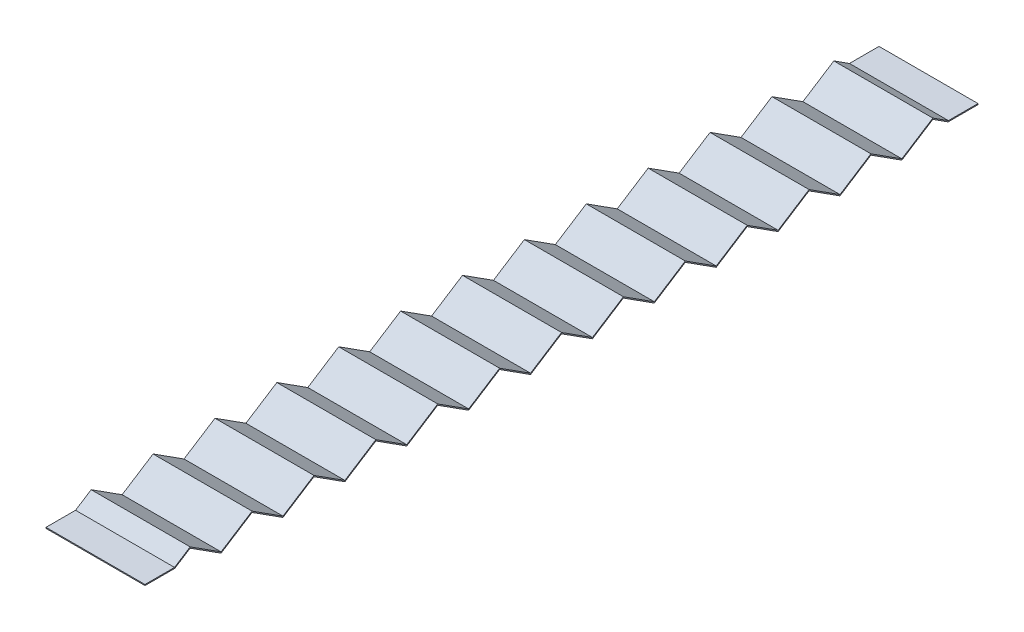
from build123d import *

# Parameters (mm, degrees)
EXTRUDE_THIN1_DEPTH = 25


with BuildPart() as part:
    # Sketch3 → Extrude-Thin1 (new, symmetric)
    with BuildSketch(Plane(origin=(0, 0, 0), x_dir=(0, 0, -1), z_dir=(1, 0, 0))):
        Polygon((0, 4.75), (15.073133494, 4.75), (22.814680899, 9.703207626), (38.444042697, -0.296792374), (54.073404494, 9.703207626), (69.702766292, -0.296792374), (85.33212809, 9.703207626), (100.961489887, -0.296792374), (116.590851685, 9.703207626), (132.220213483, -0.296792374), (147.84957528, 9.703207626), (163.478937078, -0.296792374), (179.108298876, 9.703207626), (194.737660673, -0.296792374), (210.367022471, 9.703207626), (225.996384269, -0.296792374), (241.625746066, 9.703207626), (257.255107864, -0.296792374), (272.884469662, 9.703207626), (288.513831459, -0.296792374), (304.143193257, 9.703207626), (319.772555055, -0.296792374), (335.401916852, 9.703207626), (351.03127865, -0.296792374), (366.660640448, 9.703207626), (382.290002245, -0.296792374), (397.919364043, 9.703207626), (405.660911448, 4.75), (420.734044942, 4.75), (420.734044942, 5.25), (405.807178436, 5.25), (397.919364043, 10.296792374), (382.290002245, 0.296792374), (366.660640448, 10.296792374), (351.03127865, 0.296792374), (335.401916852, 10.296792374), (319.772555055, 0.296792374), (304.143193257, 10.296792374), (288.513831459, 0.296792374), (272.884469662, 10.296792374), (257.255107864, 0.296792374), (241.625746066, 10.296792374), (225.996384269, 0.296792374), (210.367022471, 10.296792374), (194.737660673, 0.296792374), (179.108298876, 10.296792374), (163.478937078, 0.296792374), (147.84957528, 10.296792374), (132.220213483, 0.296792374), (116.590851685, 10.296792374), (100.961489887, 0.296792374), (85.33212809, 10.296792374), (69.702766292, 0.296792374), (54.073404494, 10.296792374), (38.444042697, 0.296792374), (22.814680899, 10.296792374), (14.926866506, 5.25), (0, 5.25), align=None)
    extrude(amount=EXTRUDE_THIN1_DEPTH, both=True)


solid = part.part
